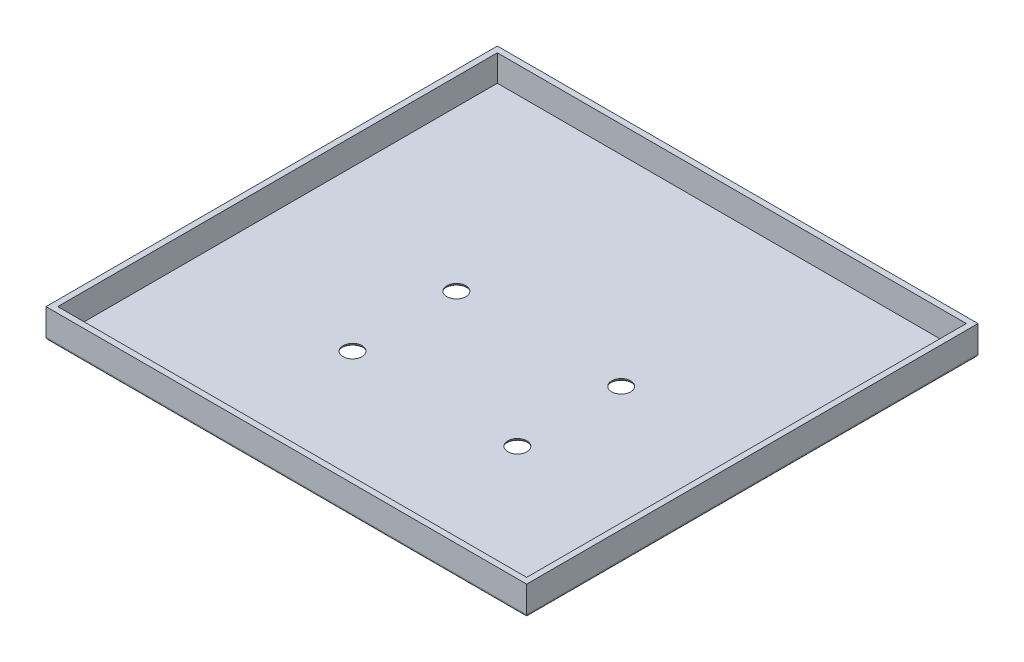
from build123d import *

# Parameters (mm, degrees)
SKETCH1_W           = 164
SKETCH1_H           = 154
SKETCH1_R           = 3.25
BOSS_EXTRUDE1_DEPTH = 10
SKETCH2_W           = 160
SKETCH2_H           = 150
CUT_EXTRUDE1_DEPTH  = 9
FILLET2_R           = 1


with BuildPart() as part:
    # Sketch1 → Boss-Extrude1 (new body)
    with BuildSketch(Plane(origin=(0, 0, 0), x_dir=(1, 0, 0), z_dir=(0, 1, 0))):
        with Locations((-30.679775281, -51.803370787)):
            Rectangle(SKETCH1_W, SKETCH1_H)
        with Locations(Location((-56.229503417, -45.223629633, 0), (0, 0, 270))):
            Circle(SKETCH1_R, mode=Mode.SUBTRACT)
        with Locations(Location((0, -45.223629633, 0), (0, 0, 270))):
            Circle(SKETCH1_R, mode=Mode.SUBTRACT)
        with Locations(Location((-56.229503417, -80.657592441, 0), (0, 0, 270))):
            Circle(SKETCH1_R, mode=Mode.SUBTRACT)
        with Locations(Location((0, -80.657592441, 0), (0, 0, 270))):
            Circle(SKETCH1_R, mode=Mode.SUBTRACT)
    extrude(amount=BOSS_EXTRUDE1_DEPTH)

    # Sketch2 → Cut-Extrude1 (cut)
    with BuildSketch(Plane(origin=(0, 10, 0), x_dir=(1, 0, 0), z_dir=(0, 1, 0))):
        with Locations((-30.679775281, -51.803370787)):
            Rectangle(SKETCH2_W, SKETCH2_H)
    extrude(amount=-CUT_EXTRUDE1_DEPTH, mode=Mode.SUBTRACT)

    # Fillet2
    fillet2_edges = [part.edges().sort_by_distance(p)[0] for p in [
        (-56.229503417, 0, 41.973629633),
        (0, 0, 41.973629633),
        (-56.229503417, 0, 77.407592441),
        (0, 0, 77.407592441),
        (-30.679775281, 0, -25.196629213),
        (51.320224719, 0, 51.803370787),
        (-30.679775281, 0, 128.803370787),
        (-112.679775281, 0, 51.803370787),
    ]]
    fillet(fillet2_edges, radius=FILLET2_R - 0.0001)  # a hair under: the kernel refuses the full size


solid = part.part
